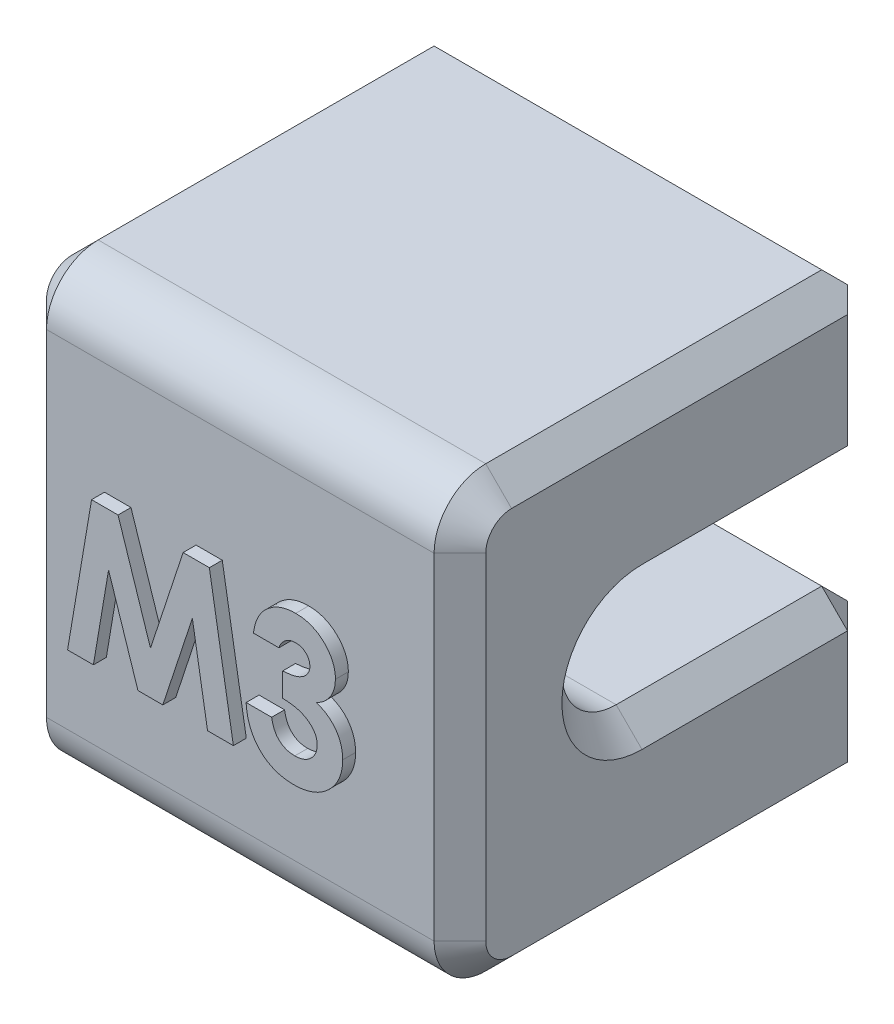
from build123d import *

# Parameters (mm, degrees)
SKETCH1_W           = 17
SKETCH1_H           = 17
BOSS_EXTRUDE1_DEPTH = 16
CUT_EXTRUDE1_DEPTH  = 29.879058156
CHAMFER1_SIZE       = 1
FILLET1_R           = 2
BOSS_EXTRUDE2_DEPTH = 0.5
CHAMFER3_SIZE       = 1


with BuildPart() as part:
    # Sketch1 → Boss-Extrude1 (new body)
    with BuildSketch(Plane.XY):
        with Locations((8.5, 8.5)):
            Rectangle(SKETCH1_W, SKETCH1_H)
    extrude(amount=BOSS_EXTRUDE1_DEPTH)

    # Sketch2 → Cut-Extrude1 (cut, through all)
    with BuildSketch(Plane.ZY):
        with BuildLine():
            Line((8.953848021, 10.6), (0, 10.6))
            Line((0, 10.6), (0, 6.4))
            Line((0, 6.4), (8.953848021, 6.4))
            ThreePointArc((8.953848021, 6.4), (11.053848021, 8.5), (8.953848021, 10.6))
        make_face()
    extrude(amount=-CUT_EXTRUDE1_DEPTH, mode=Mode.SUBTRACT)

    # Chamfer1
    chamfer1_edges = [part.edges().sort_by_distance(p)[0] for p in [
        (8.5, 10.6, 0),
        (8.5, 6.4, 0),
        (8.5, 0, 0),
        (8.5, 17, 0),
        (17, 10.6, 4.47692401),
        (0, 10.6, 4.47692401),
        (17, 8.5, 11.053848021),
        (0, 8.5, 11.053848021),
        (17, 6.4, 4.47692401),
        (0, 6.4, 4.47692401),
        (0, 3.2, 0),
        (17, 3.2, 0),
        (0, 13.8, 0),
        (17, 13.8, 0),
    ]]
    chamfer(chamfer1_edges, length=CHAMFER1_SIZE)

    # Fillet1
    fillet1_edges = [part.edges().sort_by_distance(p)[0] for p in [
        (8.5, 0, 16),
        (8.5, 17, 16),
    ]]
    fillet(fillet1_edges, radius=FILLET1_R)

    # Sketch3 → Boss-Extrude2 (add)
    with BuildSketch(Plane.XY.offset(16)):
        Polygon((3.244919175, 10.668082206), (4.269558598, 10.668082206), (5.524466451, 6.831744065), (6.788188406, 10.668082206), (7.802911963, 10.668082206), (8.732799784, 5.168082206), (7.733500906, 5.168082206), (7.146261322, 8.641940379), (6.002631515, 5.168082206), (5.039690809, 5.168082206), (3.902671579, 8.641940379), (3.316533758, 5.168082206), (2.316133117, 5.168082206), align=None)
        with BuildLine():
            Line((10.495620297, 9.328338616), (9.508440809, 9.328338616))
            add(Edge.make_bspline(
                [(9.508440809, 9.328338616), (9.515410672, 9.377684197), (9.529074626, 9.47442294), (9.56177064, 9.61447654), (9.600878602, 9.747326965), (9.649702894, 9.872553504), (9.706965845, 9.990379227), (9.772085156, 10.101208455), (9.84576479, 10.204565488), (9.90224101, 10.266828175), (9.93041597, 10.297889898)],
                knots=[0, 0, 0, 0, 1.111473889, 2.178970933, 3.205615836, 4.199322666, 5.174200091, 6.12565194, 7.064921805, 8, 8, 8, 8], degree=3))
            add(Edge.make_bspline(
                [(9.93041597, 10.297889898), (9.971054616, 10.338873592), (10.051149118, 10.419648144), (10.184996423, 10.523111423), (10.325293118, 10.612651854), (10.474852914, 10.683640156), (10.631348547, 10.741096963), (10.796024526, 10.779690829), (10.968207924, 10.805298201), (11.085701432, 10.807820616), (11.145660361, 10.809107847)],
                knots=[0, 0, 0, 0, 1.01925491, 2.00884431, 2.983262333, 3.955970413, 4.92937149, 5.924503185, 6.940838805, 8, 8, 8, 8], degree=3))
            add(Edge.make_bspline(
                [(11.145660361, 10.809107847), (11.198966933, 10.807849383), (11.303756913, 10.805375497), (11.457771816, 10.785516482), (11.604612137, 10.750685982), (11.745830021, 10.705145883), (11.879348613, 10.643180969), (12.008114798, 10.571252892), (12.128530844, 10.483030116), (12.240878502, 10.383347258), (12.344091254, 10.275530489), (12.433473949, 10.160283229), (12.510317856, 10.040683999), (12.573627071, 9.915739156), (12.622303254, 9.785237276), (12.656085968, 9.649932253), (12.678197575, 9.510122647), (12.680400469, 9.415095941), (12.681517733, 9.366900315)],
                knots=[0, 0, 0, 0, 1.091422571, 2.145516843, 3.172569842, 4.178562979, 5.178154469, 6.181868002, 7.194278174, 8.227918432, 9.254613415, 10.245994977, 11.209837596, 12.161663635, 13.10878368, 14.055455738, 15.013766427, 16, 16, 16, 16], degree=3))
            add(Edge.make_bspline(
                [(12.681517733, 9.366900315), (12.679225042, 9.307214046), (12.674711438, 9.189710131), (12.637674052, 9.017734423), (12.579700472, 8.853294955), (12.495951997, 8.698692484), (12.391245073, 8.55434775), (12.262773184, 8.425086631), (12.114195543, 8.308882488), (12.002656329, 8.246434368), (11.945540168, 8.214456405)],
                knots=[0, 0, 0, 0, 0.992805628, 1.954529043, 2.915727527, 3.886831945, 4.871318353, 5.87440735, 6.911542536, 8, 8, 8, 8], degree=3))
            add(Edge.make_bspline(
                [(11.945540168, 8.214456405), (11.984743825, 8.201585019), (12.061777251, 8.176293323), (12.171271003, 8.126481615), (12.275387051, 8.072045674), (12.372332552, 8.00880546), (12.463071747, 7.939318128), (12.547051478, 7.862989674), (12.624773506, 7.77998653), (12.69496905, 7.689852211), (12.757270338, 7.594028239), (12.813169966, 7.494728091), (12.859178476, 7.390445863), (12.898153411, 7.282372527), (12.927826708, 7.169536779), (12.948719361, 7.052375846), (12.960795827, 6.931156981), (12.962637694, 6.849031274), (12.963569015, 6.807505283)],
                knots=[0, 0, 0, 0, 1.059543567, 2.081955587, 3.086750234, 4.076226789, 5.052108497, 6.020845489, 6.989030705, 7.970690546, 8.952259656, 9.923888338, 10.895517021, 11.877585046, 12.873342345, 13.889638361, 14.932918083, 16, 16, 16, 16], degree=3))
            add(Edge.make_bspline(
                [(12.963569015, 6.807505283), (12.961681103, 6.746478937), (12.957958525, 6.626147412), (12.93429212, 6.448911389), (12.890229538, 6.279932588), (12.83226277, 6.117266652), (12.754941393, 5.96301354), (12.663947131, 5.813633354), (12.5520969, 5.674306556), (12.427794574, 5.541349707), (12.289749595, 5.420471294), (12.140086379, 5.315675149), (11.982095893, 5.225741411), (11.814778577, 5.15273064), (11.638192558, 5.096503997), (11.452731433, 5.055860787), (11.257615945, 5.030994598), (11.124434358, 5.02838785), (11.056417572, 5.027056565)],
                knots=[0, 0, 0, 0, 1.005138573, 1.981928558, 2.936866704, 3.876260664, 4.820238198, 5.773547, 6.751179199, 7.756627054, 8.768222608, 9.766606018, 10.760583154, 11.757261445, 12.767156078, 13.807575856, 14.880313354, 16, 16, 16, 16], degree=3))
            add(Edge.make_bspline(
                [(11.056417572, 5.027056565), (10.99207479, 5.02846018), (10.866260993, 5.031204763), (10.682231983, 5.054960522), (10.507329828, 5.093280489), (10.341108177, 5.147295661), (10.184210125, 5.217344107), (10.035212862, 5.300756089), (9.897089595, 5.402342616), (9.768301357, 5.517517881), (9.651705062, 5.646737988), (9.547495432, 5.787009618), (9.457970308, 5.938866167), (9.382762546, 6.10165884), (9.3224601, 6.275673225), (9.274893708, 6.460555454), (9.241667805, 6.656666729), (9.231548786, 6.791595459), (9.226389527, 6.860389898)],
                knots=[0, 0, 0, 0, 1.066544725, 2.085487077, 3.070979577, 4.031932826, 4.977951092, 5.916076795, 6.857635327, 7.814973522, 8.776389752, 9.738577119, 10.707772778, 11.69409279, 12.707140348, 13.757286496, 14.856535458, 16, 16, 16, 16], degree=3))
            Line((9.226389527, 6.860389898), (10.213569015, 6.860389898))
            add(Edge.make_bspline(
                [(10.213569015, 6.860389898), (10.219824668, 6.825799151), (10.232009194, 6.7584246), (10.255774364, 6.660881227), (10.286743696, 6.570842669), (10.322551949, 6.487508666), (10.361230253, 6.409785071), (10.407962894, 6.340542409), (10.459325549, 6.277900458), (10.533442235, 6.203431016), (10.639397142, 6.126916773), (10.782471369, 6.060422256), (10.941627897, 6.0214483), (11.052894184, 6.016693597), (11.110403951, 6.014236052)],
                knots=[0, 0, 0, 0, 0.928156231, 1.807827665, 2.648129825, 3.438902246, 4.202261636, 4.936546065, 5.639352463, 6.338805438, 7.70633318, 9.064371875, 10.482673459, 12, 12, 12, 12], degree=3))
            add(Edge.make_bspline(
                [(11.110403951, 6.014236052), (11.140920666, 6.014759363), (11.200696083, 6.015784412), (11.288497271, 6.027145709), (11.372140265, 6.045857774), (11.451780855, 6.071286777), (11.527926037, 6.103163621), (11.599120982, 6.144266905), (11.66681682, 6.192055339), (11.730277635, 6.245782226), (11.788916737, 6.304325301), (11.837707918, 6.369151809), (11.882299527, 6.435027129), (11.915279803, 6.506261054), (11.944177629, 6.57902044), (11.961864575, 6.655946223), (11.975219489, 6.735424708), (11.975995623, 6.789816294), (11.976389527, 6.817421148)],
                knots=[0, 0, 0, 0, 1.110435564, 2.175094844, 3.216326037, 4.226890168, 5.215276772, 6.21526065, 7.213097102, 8.228249917, 9.239874822, 10.221364777, 11.178138315, 12.128914389, 13.072518965, 14.022636769, 14.996447288, 16, 16, 16, 16], degree=3))
            add(Edge.make_bspline(
                [(11.976389527, 6.817421148), (11.975343786, 6.84761176), (11.973261954, 6.907714349), (11.95625317, 6.99542144), (11.929392706, 7.079788593), (11.892080239, 7.16044219), (11.842253599, 7.237084958), (11.783458719, 7.311254584), (11.711063536, 7.37909067), (11.631636324, 7.446144585), (11.539531961, 7.504595376), (11.43923606, 7.558536867), (11.328112687, 7.601457641), (11.208874464, 7.639793843), (11.079265887, 7.667794008), (10.94009178, 7.688124858), (10.791576649, 7.703258025), (10.689203239, 7.705429126), (10.636645938, 7.706543745)],
                knots=[0, 0, 0, 0, 0.809814727, 1.612155564, 2.388397, 3.182215007, 3.988903953, 4.837162975, 5.715530372, 6.646997145, 7.623086902, 8.637258368, 9.698941581, 10.815059213, 11.996518529, 13.252603015, 14.589518788, 16, 16, 16, 16], degree=3))
            Line((10.636645938, 7.706543745), (10.636645938, 8.623210411))
            add(Edge.make_bspline(
                [(10.636645938, 8.623210411), (10.702082904, 8.628783233), (10.824502508, 8.639208878), (10.994427483, 8.663589612), (11.137482407, 8.696178476), (11.257105609, 8.735495178), (11.356433051, 8.785988065), (11.443204956, 8.841729984), (11.517937025, 8.906466075), (11.581095648, 8.978265919), (11.631620581, 9.055372218), (11.667379186, 9.136586513), (11.6909923, 9.219395932), (11.693229641, 9.276035079), (11.694338245, 9.304099834)],
                knots=[0, 0, 0, 0, 1.70044513, 3.18119609, 4.440695891, 5.496282586, 6.431922213, 7.318171381, 8.16090191, 8.983045123, 9.787564368, 10.536848927, 11.275007137, 12, 12, 12, 12], degree=3))
            add(Edge.make_bspline(
                [(11.694338245, 9.304099834), (11.692425585, 9.339907415), (11.688692477, 9.409796232), (11.659699137, 9.509821852), (11.609369984, 9.598986402), (11.541887427, 9.677102254), (11.459657586, 9.742350468), (11.363269796, 9.789719559), (11.254815679, 9.817551015), (11.178512364, 9.820436199), (11.139049784, 9.82192836)],
                knots=[0, 0, 0, 0, 1.009664648, 1.970651636, 2.907870547, 3.878035693, 4.867062054, 5.849714035, 6.887914197, 8, 8, 8, 8], degree=3))
            add(Edge.make_bspline(
                [(11.139049784, 9.82192836), (11.103281391, 9.820167767), (11.032305946, 9.816674212), (10.9285186, 9.79059924), (10.8299552, 9.746705269), (10.738656716, 9.686178071), (10.655941059, 9.613487472), (10.588055369, 9.527400545), (10.531591271, 9.433074908), (10.507657627, 9.363387579), (10.495620297, 9.328338616)],
                knots=[0, 0, 0, 0, 0.98818071, 1.960853194, 2.938124878, 3.957524365, 4.978590984, 5.968022688, 6.978025184, 8, 8, 8, 8], degree=3))
        make_face()
    extrude(amount=BOSS_EXTRUDE2_DEPTH)

    # Chamfer3
    chamfer3_edges = [part.edges().sort_by_distance(p)[0] for p in [
        (17, 0, 7.5),
        (17, 0.585786438, 15.414213562),
        (17, 8.5, 16),
        (17, 16.414213562, 15.414213562),
        (17, 17, 7.5),
        (0, 0, 7.5),
        (0, 0.585786438, 15.414213562),
        (0, 8.5, 16),
        (0, 16.414213562, 15.414213562),
        (0, 17, 7.5),
    ]]
    chamfer(chamfer3_edges, length=CHAMFER3_SIZE)


solid = part.part
